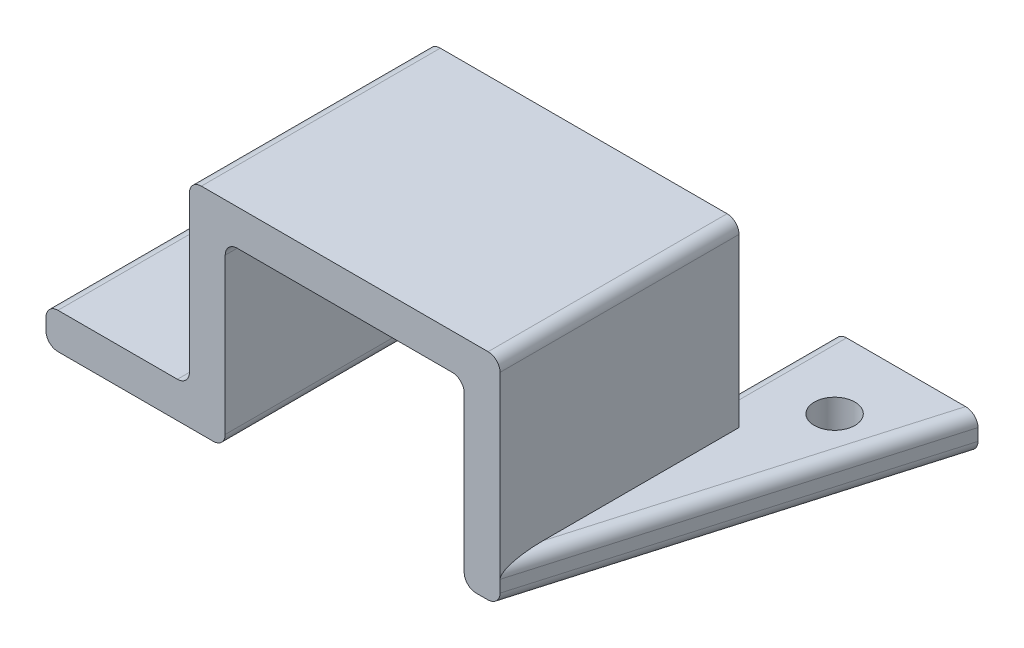
from build123d import *

# Parameters (mm, degrees)
BOSS_EXTRUDE1_DEPTH  = 20
SKETCH7_W            = 12
SKETCH7_H            = 20
BOSS_EXTRUDE2_DEPTH  = 3
M3_CLEARANCE_HOLE2_D = 3.4
FILLET1_R            = 1


with BuildPart() as part:
    # Sketch3 → Boss-Extrude1 (new body)
    with BuildSketch(Plane.XY):
        Polygon((3, 0), (3, 15), (23, 15), (23, 0), (26, 0), (26, 18), (0, 18), (0, 0), align=None)
    extrude(amount=BOSS_EXTRUDE1_DEPTH)

    # Sketch7 → Boss-Extrude2 (add)
    with BuildSketch(Plane(origin=(0, 0, 0), x_dir=(1, 0, 0), z_dir=(0, 1, 0))):
        Polygon((26, -20), (35, 11), (23, 11), (23, 0), (26, 0), align=None)
        with Locations((-6, -10)):
            Rectangle(SKETCH7_W, SKETCH7_H)
    extrude(amount=BOSS_EXTRUDE2_DEPTH)

    # M3 Clearance Hole2 (through all)
    with Locations(Plane(origin=(0, 3, 0), x_dir=(1, 0, 0), z_dir=(0, 1, 0))):
        with Locations((29, 5), (-6, -10)):
            Hole(M3_CLEARANCE_HOLE2_D / 2)

    # Fillet1
    fillet1_edges = [part.edges().sort_by_distance(p)[0] for p in [
        (3, 0, 10),
        (-12, 0, 10),
        (-12, 3, 10),
        (0, 3, 10),
        (23, 3, -5.5),
        (23, 0, 4.5),
        (0, 18, 10),
        (30.5, 3, 4.5),
        (30.5, 0, 4.5),
        (26, 18, 10),
        (3, 15, 10),
        (23, 15, 10),
    ]]
    fillet(fillet1_edges, radius=FILLET1_R)


solid = part.part
